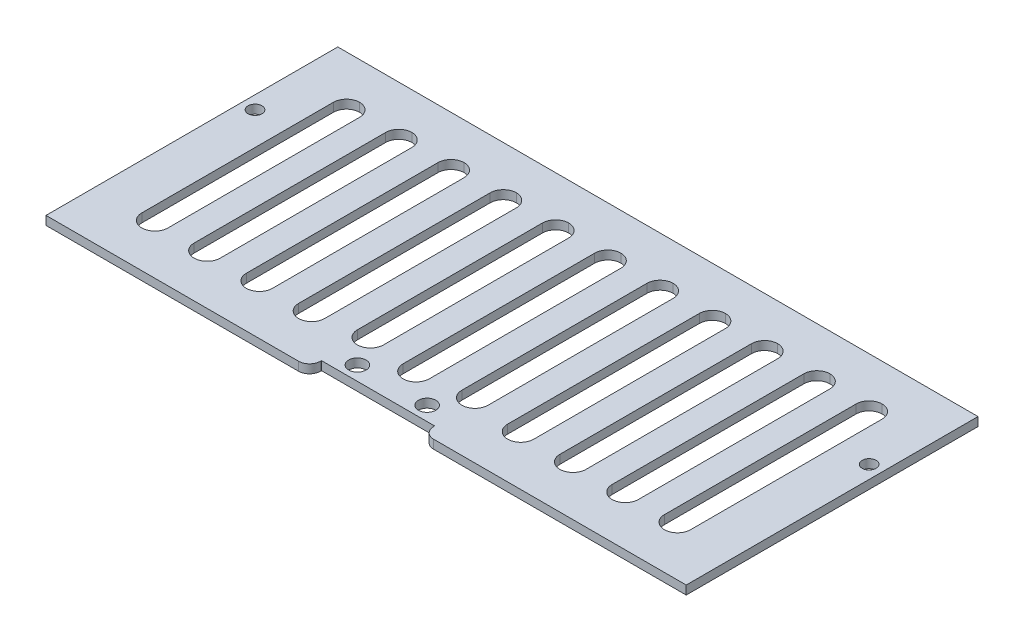
from build123d import *

# Parameters (mm, degrees)
SKETCH_1_W          = 147
SKETCH_1_H          = 70
EXTRUDE_1_DEPTH     = 2
SKETCH_3_W          = 147
SKETCH_3_H          = 3
CUT_EXTRUDE_1_DEPTH = 82.432487375
SKETCH_5_R          = 2
CUT_EXTRUDE_3_DEPTH = 10
SKETCH_6_R          = 1.6
CUT_EXTRUDE_4_DEPTH = 10
SKETCH_7_W          = 6
SKETCH_7_H          = 48.5
SKETCH_7_H_2        = 50
CUT_EXTRUDE_5_DEPTH = 10
FILLET_1_R          = 3
SKETCH_8_W          = 26
SKETCH_8_H          = 5.5
CUT_EXTRUDE_6_DEPTH = 82.432487375
FILLET_2_R          = 2.5


with BuildPart() as part:
    # 草图1 → 凸台-拉伸1 (new body)
    with BuildSketch(Plane(origin=(0, 0, 0), x_dir=(1, 0, 0), z_dir=(0, 1, 0))):
        Rectangle(SKETCH_1_W, SKETCH_1_H)
    extrude(amount=EXTRUDE_1_DEPTH)

    # 草图3 → 切除-拉伸1 (cut, through all)
    with BuildSketch(Plane(origin=(0, 2, 0), x_dir=(1, 0, 0), z_dir=(0, 1, 0))):
        with Locations((0, 33.5)):
            Rectangle(SKETCH_3_W, SKETCH_3_H)
    extrude(amount=-CUT_EXTRUDE_1_DEPTH, mode=Mode.SUBTRACT)

    # 草图5 → 切除-拉伸3 (cut)
    with BuildSketch(Plane(origin=(0, 2, 0), x_dir=(1, 0, 0), z_dir=(0, 1, 0))):
        with Locations(Location((-8, -29, 0), (0, 0, 270))):
            Circle(SKETCH_5_R)
        with Locations(Location((8, -29, 0), (0, 0, 270))):
            Circle(SKETCH_5_R)
    extrude(amount=-CUT_EXTRUDE_3_DEPTH, mode=Mode.SUBTRACT)

    # 草图6 → 切除-拉伸4 (cut)
    with BuildSketch(Plane(origin=(0, 2, 0), x_dir=(1, 0, 0), z_dir=(0, 1, 0))):
        with Locations(Location((-70.5, 10, 0), (0, 0, 270))):
            Circle(SKETCH_6_R)
        with Locations(Location((70.5, 10, 0), (0, 0, 270))):
            Circle(SKETCH_6_R)
    extrude(amount=-CUT_EXTRUDE_4_DEPTH, mode=Mode.SUBTRACT)

    # 草图7 → 切除-拉伸5 (cut)
    with BuildSketch(Plane(origin=(0, 2, 0), x_dir=(1, 0, 0), z_dir=(0, 1, 0))):
        with Locations((12, -0.75)):
            Rectangle(SKETCH_7_W, SKETCH_7_H)
        with Locations((0, -1.5)):
            Rectangle(SKETCH_7_W, SKETCH_7_H_2)
        with Locations((24, -1.5)):
            Rectangle(SKETCH_7_W, SKETCH_7_H_2)
        with Locations((36, -1.5)):
            Rectangle(SKETCH_7_W, SKETCH_7_H_2)
        with Locations((48, -1.5)):
            Rectangle(SKETCH_7_W, SKETCH_7_H_2)
        with Locations((60, -1.5)):
            Rectangle(SKETCH_7_W, SKETCH_7_H_2)
        with Locations((-12, -0.75)):
            Rectangle(SKETCH_7_W, SKETCH_7_H)
        with Locations((-24, -1.5)):
            Rectangle(SKETCH_7_W, SKETCH_7_H_2)
        with Locations((-36, -1.5)):
            Rectangle(SKETCH_7_W, SKETCH_7_H_2)
        with Locations((-48, -1.5)):
            Rectangle(SKETCH_7_W, SKETCH_7_H_2)
        with Locations((-60, -1.5)):
            Rectangle(SKETCH_7_W, SKETCH_7_H_2)
    extrude(amount=-CUT_EXTRUDE_5_DEPTH, mode=Mode.SUBTRACT)

    # 圆角1
    fillet_1_edges = [part.edges().sort_by_distance(p)[0] for p in [
        (-63, 1, -23.5),
        (-57, 1, -23.5),
        (-57, 1, 26.5),
        (-63, 1, 26.5),
        (-27, 1, -23.5),
        (-39, 1, -23.5),
        (-51, 1, -23.5),
        (-3, 1, -23.5),
        (-15, 1, -23.5),
        (9, 1, -23.5),
        (33, 1, -23.5),
        (21, 1, -23.5),
        (45, 1, -23.5),
        (57, 1, -23.5),
        (63, 1, -23.5),
        (51, 1, -23.5),
        (39, 1, -23.5),
        (27, 1, -23.5),
        (15, 1, -23.5),
        (3, 1, -23.5),
        (-9, 1, -23.5),
        (-21, 1, -23.5),
        (-33, 1, -23.5),
        (-45, 1, -23.5),
        (-45, 1, 26.5),
        (-33, 1, 26.5),
        (-21, 1, 26.5),
        (3, 1, 26.5),
        (27, 1, 26.5),
        (39, 1, 26.5),
        (51, 1, 26.5),
        (63, 1, 26.5),
        (21, 1, 26.5),
        (33, 1, 26.5),
        (45, 1, 26.5),
        (57, 1, 26.5),
        (-3, 1, 26.5),
        (-27, 1, 26.5),
        (-39, 1, 26.5),
        (-51, 1, 26.5),
        (15, 1, 25),
        (9, 1, 25),
        (-15, 1, 25),
        (-9, 1, 25),
    ]]
    fillet(fillet_1_edges, radius=FILLET_1_R - 0.0001)  # a hair under: the kernel refuses the full size

    # 草图8 → 切除-拉伸6 (cut, through all)
    with BuildSketch(Plane(origin=(0, 2, 0), x_dir=(1, 0, 0), z_dir=(0, 1, 0))):
        with Locations((0, -35)):
            Rectangle(SKETCH_8_W, SKETCH_8_H)
    extrude(amount=-CUT_EXTRUDE_6_DEPTH, mode=Mode.SUBTRACT)

    # 圆角2
    fillet_2_edges = [part.edges().sort_by_distance(p)[0] for p in [
        (13, 1, 35),
        (-13, 1, 35),
    ]]
    fillet(fillet_2_edges, radius=FILLET_2_R)


solid = part.part
